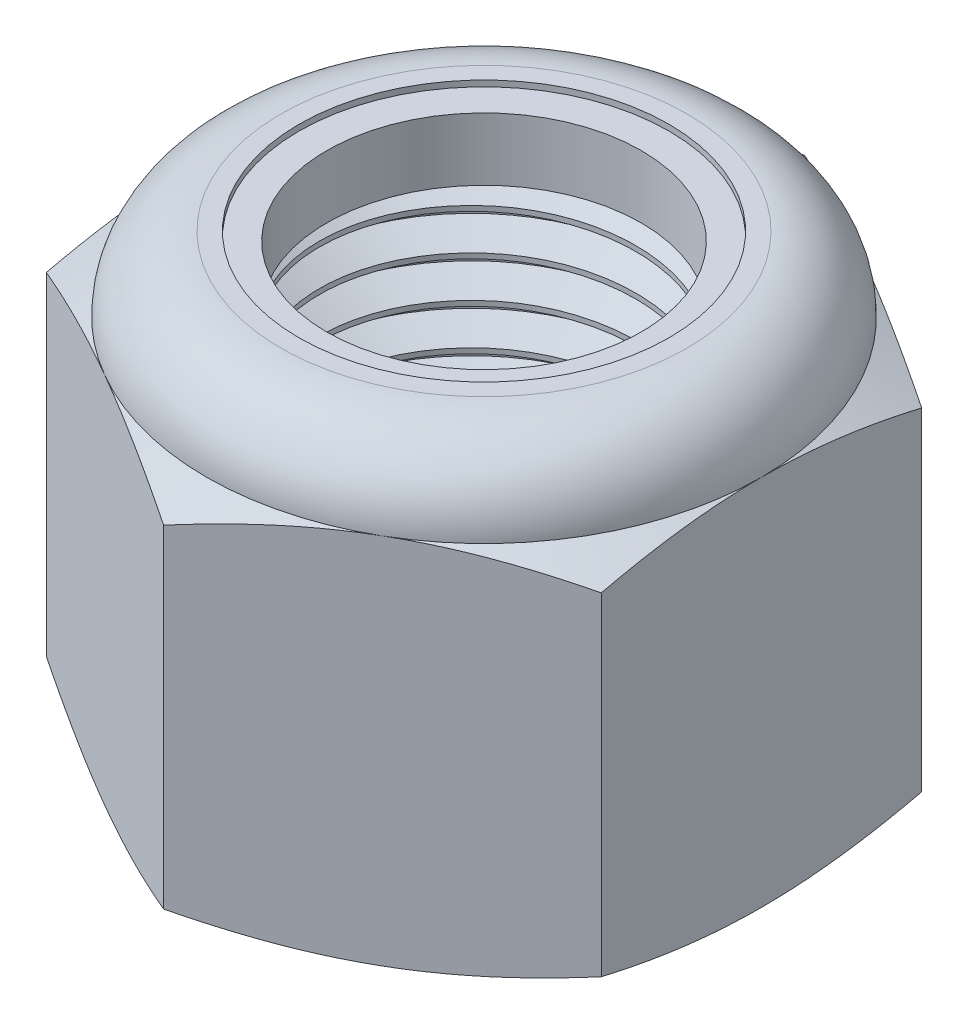
from build123d import *

# Parameters (mm, degrees)
SKETCH13_R       = 4.7625
EXTRUDE1_DEPTH   = 11.509375
SKETCH2_W        = 4.7625
SKETCH2_H        = 9.591145833
CUT_SWEEP1_PITCH = 1.058333333
SKETCH12_W       = 5.23875
SKETCH12_H       = 9.591145833


with BuildPart() as part:
    # Sketch13 → Extrude1 (new body)
    with BuildSketch(Plane(origin=(0, 0, 0), x_dir=(1, 0, 0), z_dir=(0, 1, 0))):
        Polygon((0, 8.248891971), (-7.14375, 4.124445986), (-7.14375, -4.124445986), (0, -8.248891971), (7.14375, -4.124445986), (7.14375, 4.124445986), align=None)
        with Locations(Location((0, 0, 0), (0, 0, 90))):
            Circle(SKETCH13_R, mode=Mode.SUBTRACT)
    extrude(amount=EXTRUDE1_DEPTH)

    # Sketch5 → Cut-Revolve3 (revolve, cut)
    with BuildSketch(Plane(origin=(0, 0, 0), x_dir=(0, 0, -1), z_dir=(1, 0, 0))):
        with BuildLine():
            Line((0, 0), (7.14375, 0))
            Line((7.14375, 0), (8.248891971, 0.515336164))
            Line((8.248891971, 0.515336164), (8.248891971, 9.075809669))
            Line((8.248891971, 9.075809669), (7.14375, 9.591145833))
            ThreePointArc((7.14375, 9.591145833), (6.581913685, 10.947538685), (5.225520833, 11.509375))
            Line((5.225520833, 11.509375), (5.225520833, 12.779375))
            Line((5.225520833, 12.779375), (9.518891971, 12.779375))
            Line((9.518891971, 12.779375), (9.518891971, -1.27))
            Line((9.518891971, -1.27), (0, -1.27))
            Line((0, -1.27), (0, 0))
        make_face()
    revolve(axis=Axis((0, 0, 0), (0, 1, 0)), mode=Mode.SUBTRACT)

    # Sketch6 → Cut-Revolve4 (revolve, cut)
    with BuildSketch(Plane(origin=(0, 0, 0), x_dir=(0, 0, -1), z_dir=(1, 0, 0))):
        with BuildLine():
            Line((0, 9.591145833), (6.99135, 9.591145833))
            ThreePointArc((6.99135, 9.591145833), (6.474150612, 10.839775612), (5.225520833, 11.356975))
            Line((5.225520833, 11.356975), (2.612760417, 11.356975))
            Line((2.612760417, 11.356975), (2.612760417, 12.779375))
            Line((2.612760417, 12.779375), (0, 12.779375))
            Line((0, 12.779375), (0, 9.591145833))
        make_face()
    revolve(axis=Axis((0, 12.779375, 0), (0, -1, 0)), mode=Mode.SUBTRACT)

    # Sketch4 → Cut-Revolve2 (revolve, cut)
    with BuildSketch(Plane(origin=(0, 0, 0), x_dir=(0, 0, -1), z_dir=(1, 0, 0))):
        Polygon((0, 9.591145833), (5.23875, 9.591145833), (0, 7.148276589), align=None)
        Polygon((0, 2.442869244), (5.23875, 0), (0, 0), align=None)
    revolve(axis=Axis((0, 0, 0), (0, 1, 0)), mode=Mode.SUBTRACT)

    # Sketch12 → Revolve4 (revolve)
    with BuildSketch(Plane(origin=(0, 0, 0), x_dir=(0, 0, -1), z_dir=(1, 0, 0)), mode=Mode.PRIVATE) as revolve4_sk:
        with Locations((2.619375, 4.795572917)):
            Rectangle(SKETCH12_W, SKETCH12_H)
    revolve(revolve4_sk.sketch.rotate(Axis((0, 0, 0), (0, 1, 0)), 180), axis=Axis((0, 0, 0), (0, 1, 0)))


with BuildPart() as body_2:
    # Sketch7 → Revolve2 (revolve)
    with BuildSketch(Plane(origin=(0, 0, 0), x_dir=(0, 0, -1), z_dir=(1, 0, 0))):
        with BuildLine():
            Line((4.048125, 9.667345833), (6.913430867, 9.667345833))
            ThreePointArc((6.913430867, 9.667345833), (6.39301751, 10.812537757), (5.225520833, 11.280775))
            Line((5.225520833, 11.280775), (4.048125, 11.280775))
            Line((4.048125, 11.280775), (4.048125, 9.667345833))
        make_face()
    revolve(axis=Axis((0, 9.667345833, 0), (0, 1, 0)))


with BuildPart() as body_3:
    # Sketch2 → Revolve1 (revolve)
    with BuildSketch(Plane(origin=(0, 0, 0), x_dir=(0, 0, -1), z_dir=(1, 0, 0)), mode=Mode.PRIVATE) as revolve1_sk:
        with Locations((2.38125, 4.795572917)):
            Rectangle(SKETCH2_W, SKETCH2_H)
    revolve(revolve1_sk.sketch.rotate(Axis((0, -4.7625, 0), (0, 1, 0)), 180), axis=Axis((0, -4.7625, 0), (0, 1, 0)))

    # Cut-Sweep1: the profile of Sketch9 screwed along a right-hand helix of 11.875 turns, 8 arcs to a turn; built about Z, then put on its axis
    cut_sweep1_z = Axis((0, 0, 0), (0, 0, 1))
    cut_sweep1_corners = [(4.877067944, 0, 0.066145833), (4.819783972, 0, -0.959114583), (4.075092336, 0, -0.529166667), (4.075092336, 0, -0.396875)]
    with BuildLine(mode=Mode.PRIVATE) as cut_sweep1_profile:
        Line(cut_sweep1_corners[0], cut_sweep1_corners[1])
        Line(cut_sweep1_corners[1], cut_sweep1_corners[2])
        Line(cut_sweep1_corners[2], cut_sweep1_corners[3])
        Line(cut_sweep1_corners[3], cut_sweep1_corners[0])
    cut_sweep1_cap = Face(cut_sweep1_profile.wire())
    cut_sweep1_turn_angles = [0, 22.5, 45, 67.5, 90, 112.5, 135, 157.5, 180, 202.5, 225, 247.5, 270, 292.5, 315, 337.5, 360]
    cut_sweep1_turn_weights = [1, 0.9238795325112867, 1, 0.9238795325112867, 1, 0.9238795325112867, 1, 0.9238795325112867, 1, 0.9238795325112867, 1, 0.9238795325112867, 1, 0.9238795325112867, 1, 0.9238795325112867, 1]
    cut_sweep1_turn_rails = [Edge.make_bspline([Vector(p[0], p[1], 0).rotate(cut_sweep1_z, cut_sweep1_turn_angles[k]) / cut_sweep1_turn_weights[k] + Vector(0, 0, p[2] + CUT_SWEEP1_PITCH * cut_sweep1_turn_angles[k] / 360) for k in range(17)], [0, 0, 0, 1, 1, 2, 2, 3, 3, 4, 4, 5, 5, 6, 6, 7, 7, 8, 8, 8], 2, cut_sweep1_turn_weights) for p in cut_sweep1_corners]
    cut_sweep1_turn_sides = [Face.make_surface_from_curves(cut_sweep1_turn_rails[p[0]], cut_sweep1_turn_rails[p[1]]) for p in [(0, 1), (1, 2), (2, 3), (3, 0)]]
    cut_sweep1_last_angles = [3960, 3982.5, 4005, 4027.5, 4050, 4072.5, 4095, 4117.5, 4140, 4162.5, 4185, 4207.5, 4230, 4252.5, 4275]
    cut_sweep1_last_weights = [1, 0.9238795325112867, 1, 0.9238795325112867, 1, 0.9238795325112867, 1, 0.9238795325112867, 1, 0.9238795325112867, 1, 0.9238795325112867, 1, 0.923879532511384, 1]
    cut_sweep1_last_rails = [Edge.make_bspline([Vector(p[0], p[1], 0).rotate(cut_sweep1_z, cut_sweep1_last_angles[k]) / cut_sweep1_last_weights[k] + Vector(0, 0, p[2] + CUT_SWEEP1_PITCH * cut_sweep1_last_angles[k] / 360) for k in range(15)], [0, 0, 0, 1, 1, 2, 2, 3, 3, 4, 4, 5, 5, 6, 6, 7, 7, 7], 2, cut_sweep1_last_weights) for p in cut_sweep1_corners]
    cut_sweep1_last_sides = [Face.make_surface_from_curves(cut_sweep1_last_rails[p[0]], cut_sweep1_last_rails[p[1]]) for p in [(0, 1), (1, 2), (2, 3), (3, 0)]]
    cut_sweep1 = Plane(origin=(0, 9.591145833, 0), x_dir=(0, 0, -1), z_dir=(0, -1, 0)) * Solid(Shell([*[p.moved(Location((0, 0, CUT_SWEEP1_PITCH * i))) for i in range(11) for p in cut_sweep1_turn_sides], *cut_sweep1_last_sides, cut_sweep1_cap, cut_sweep1_cap.rotate(cut_sweep1_z, 4275).moved(Location((0, 0, CUT_SWEEP1_PITCH * 4275 / 360)))]))
    add(cut_sweep1, mode=Mode.SUBTRACT)

    # Sketch11 → Revolve3 (revolve)
    with BuildSketch(Plane(origin=(0, 0, 0), x_dir=(0, 0, -1), z_dir=(1, 0, 0)), mode=Mode.PRIVATE) as revolve3_sk:
        Polygon((0, 0), (5.23875, 0), (0, 2.442869244), align=None)
    revolve(revolve3_sk.sketch.rotate(Axis((0, 11.509375, 0), (0, -1, 0)), 18.035124002), axis=Axis((0, 11.509375, 0), (0, -1, 0)))


with BuildPart() as part_1:
    add(part.part)

    # Combine1: cut body 3
    add(body_3.part, mode=Mode.SUBTRACT)


solid = Compound([body_2.part, part_1.part])
